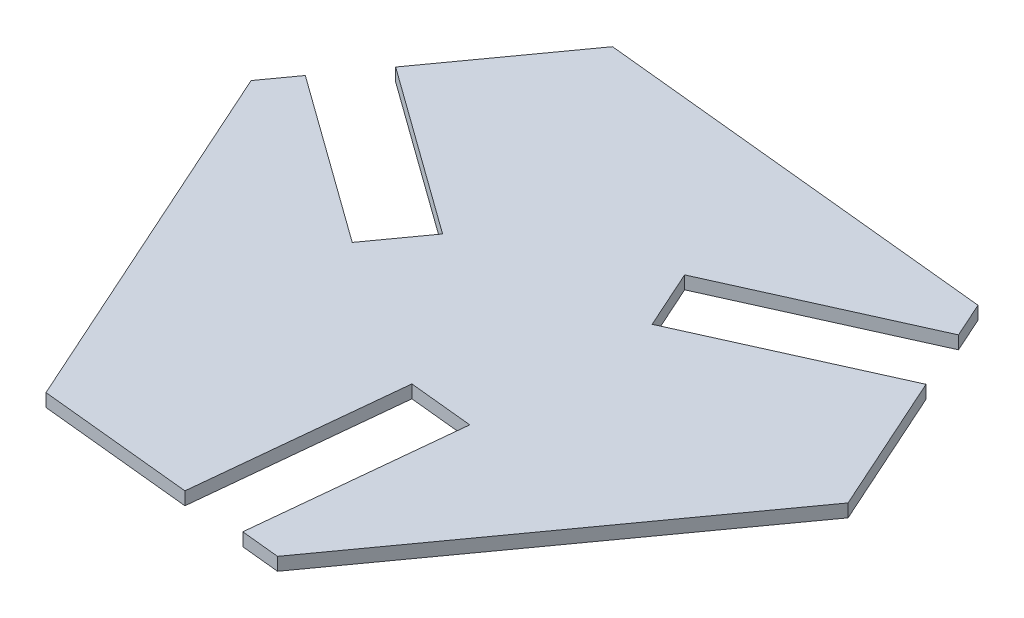
from build123d import *

# Parameters (mm, degrees)
BOSS_EXTRUDE2_DEPTH = 3.175


with BuildPart() as part:
    # Sketch1 → Boss-Extrude2 (new body)
    with BuildSketch(Plane(origin=(0, 0, 0), x_dir=(1, 0, 0), z_dir=(0, 1, 0))):
        Polygon((-43.253658108, 70.31090641), (56.468803179, 60.214423252), (60.376161728, 51.527756792), (14.047273945, 30.688511201), (20.559538192, 16.210733769), (66.888425975, 37.04997936), (82.517860169, 2.303313523), (23.912818621, -79.0106297), (14.436265518, -78.051168235), (19.553393332, -27.509551691), (3.759138161, -25.910449249), (-1.357989652, -76.452065794), (-39.26420206, -72.614219934), (-80.3816218, 18.796206449), (-74.812427246, 26.523411443), (-33.600667277, -3.17895951), (-24.318676354, 9.69971548), (-65.530436323, 39.402086433), align=None)
    extrude(amount=BOSS_EXTRUDE2_DEPTH)


solid = part.part
